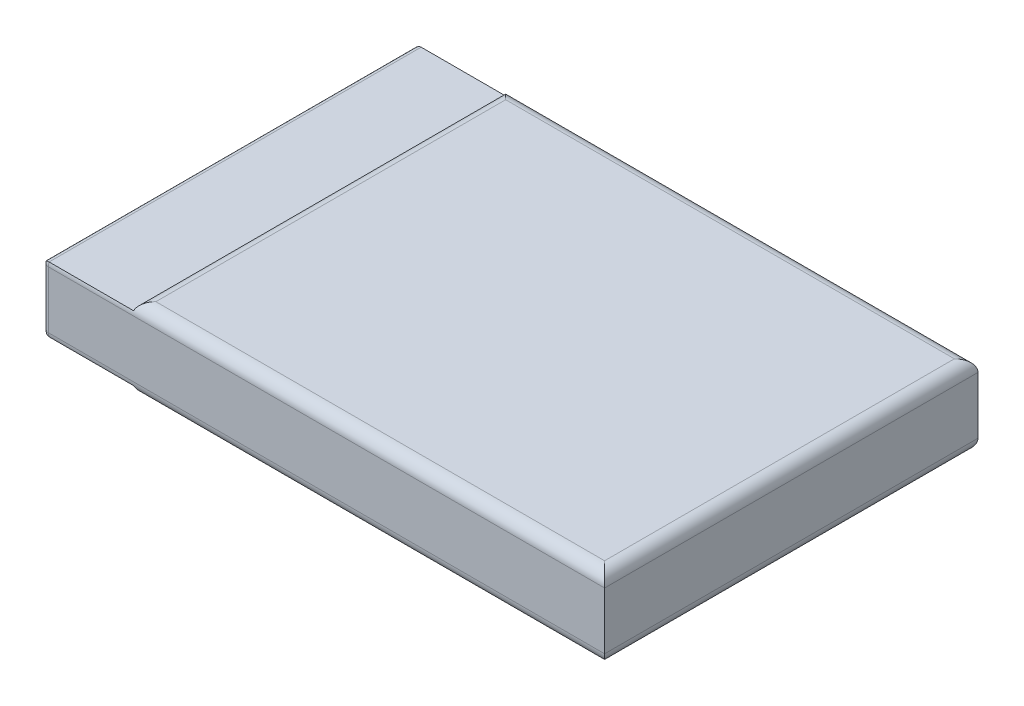
from build123d import *

# Parameters (mm, degrees)
SKETCH1_W           = 30.48
SKETCH1_H           = 24.13
BOSS_EXTRUDE1_DEPTH = 5.207
SKETCH2_W           = 24.13
SKETCH2_H           = 4.191
BOSS_EXTRUDE2_DEPTH = 5.842
FILLET5_START       = -22
FILLET5_DEPTH       = 37.24
FILLET5_START_2     = -13
FILLET5_2_DEPTH     = 26
FILLET4_R           = 0.381


with BuildPart() as part:
    # Sketch1 → Boss-Extrude1 (new body)
    with BuildSketch(Plane(origin=(0, 0, 0), x_dir=(1, 0, 0), z_dir=(0, 1, 0))):
        Rectangle(SKETCH1_W, SKETCH1_H)
    extrude(amount=BOSS_EXTRUDE1_DEPTH)

    # Sketch2 → Boss-Extrude2 (add)
    with BuildSketch(Plane.ZY.offset(15.24)):
        with Locations((0, 2.6035)):
            Rectangle(SKETCH2_W, SKETCH2_H)
    extrude(amount=BOSS_EXTRUDE2_DEPTH)

    # Fillet5: read off the stored shape, not the designer's step
    # Fillet5 outline → Fillet5 (cut)
    with BuildSketch(Plane.YZ.offset(FILLET5_START)):
        with BuildLine():
            Line((4.445, -12.065), (5.207, -12.065))
            Line((5.207, -12.065), (5.207, -11.303))
            ThreePointArc((5.207, -11.303), (4.983815367, -11.841815367), (4.445, -12.065))
        make_face()
        with BuildLine():
            ThreePointArc((0.762, -12.065), (0.223184633, -11.841815367), (0, -11.303))
            Line((0, -11.303), (0, -12.065))
            Line((0, -12.065), (0.762, -12.065))
        make_face()
        with BuildLine():
            Line((5.207, 12.065), (4.445, 12.065))
            ThreePointArc((4.445, 12.065), (4.983815367, 11.841815367), (5.207, 11.303))
            Line((5.207, 11.303), (5.207, 12.065))
        make_face()
        with BuildLine():
            Line((0.762, 12.065), (0, 12.065))
            Line((0, 12.065), (0, 11.303))
            ThreePointArc((0, 11.303), (0.223184633, 11.841815367), (0.762, 12.065))
        make_face()
    extrude(amount=FILLET5_DEPTH, mode=Mode.SUBTRACT)

    # Fillet5 2 outline → Fillet5 2 (cut)
    with BuildSketch(Plane.XY.offset(FILLET5_START_2)):
        with BuildLine():
            Line((-15.24, 5.207), (-15.24, 4.699))
            ThreePointArc((-15.24, 4.699), (-14.961520415, 5.067170395), (-14.52157951, 5.207))
            Line((-14.52157951, 5.207), (-15.24, 5.207))
        make_face()
        with BuildLine():
            Line((-15.24, 0), (-14.52157951, 0))
            ThreePointArc((-14.52157951, 0), (-14.961520415, 0.139829605), (-15.24, 0.508))
            Line((-15.24, 0.508), (-15.24, 0))
        make_face()
        with BuildLine():
            Line((15.24, 0), (15.24, 0.762))
            ThreePointArc((15.24, 0.762), (15.016815367, 0.223184633), (14.478, 0))
            Line((14.478, 0), (15.24, 0))
        make_face()
        with BuildLine():
            Line((15.24, 5.207), (14.478, 5.207))
            ThreePointArc((14.478, 5.207), (15.016815367, 4.983815367), (15.24, 4.445))
            Line((15.24, 4.445), (15.24, 5.207))
        make_face()
    extrude(amount=FILLET5_2_DEPTH, mode=Mode.SUBTRACT)

    # Fillet4
    # the kernel refuses this fillet: 0.381 mm, written as the material it takes off along each edge
    with BuildSketch(Plane(origin=(-21.082, 0.762, -12.065), x_dir=(1, 0, 0), z_dir=(0, 1, 0))) as fillet4_piece_1:
        with BuildLine():
            CenterArc((FILLET4_R, -FILLET4_R), FILLET4_R, 90, 90)
            Line((0, -FILLET4_R), (0, 0))
            Line((0, 0), (FILLET4_R, 0))
        make_face()
    extrude(amount=3.683, mode=Mode.SUBTRACT)
    with BuildSketch(Plane(origin=(-21.082, 4.445, 12.065), x_dir=(0, 0, -1), z_dir=(0, -1, 0))) as fillet4_piece_2:
        with BuildLine():
            CenterArc((FILLET4_R, FILLET4_R), FILLET4_R, 180, 90)
            Line((0, FILLET4_R), (0, 0))
            Line((0, 0), (FILLET4_R, 0))
        make_face()
    extrude(amount=3.683, mode=Mode.SUBTRACT)
    with BuildSketch(Plane(origin=(-21.082, 0.508, 12.973920489), x_dir=(0, 1, 0), z_dir=(0, 0, -1)), Plane(origin=(-21.082, 4.699, -12.973920489), x_dir=(0, -1, 0), z_dir=(0, 0, 1))) as fillet4_piece_3:
        with BuildLine():
            CenterArc((FILLET4_R, FILLET4_R), FILLET4_R, 180, 90)
            Line((0, FILLET4_R), (0, 0))
            Line((0, 0), (FILLET4_R, 0))
        make_face()
    extrude(amount=25.947840979, mode=Mode.SUBTRACT)
    with BuildSketch(Plane(origin=(-21.082, 4.444999999, 11.302999999), x_dir=(0, 1.1835443663887322e-09, 1.0), z_dir=(0, -1.0, 1.1835443663887322e-09))) as fillet4_piece_4:
        with BuildLine():
            CenterArc((0.762000001 - FILLET4_R, -FILLET4_R), FILLET4_R, 0, 90)
            Line((0.762000001, -FILLET4_R), (0.762000001, 0))
            Line((0.762000001, 0), (0.762000001 - FILLET4_R, 0))
        make_face()
    revolve(axis=Axis((-21.082, 4.444999999, 11.302999999), (-1, 0, 0)), revolution_arc=91.092291179, mode=Mode.SUBTRACT)
    with BuildSketch(Plane(origin=(-21.082, 0.762000001, 11.302999999), x_dir=(0, -0.9998182859562426, -0.019062923897481165), z_dir=(0, 0.019062923897481165, -0.9998182859562426))) as fillet4_piece_5:
        with BuildLine():
            CenterArc((0.762000001 - FILLET4_R, -FILLET4_R), FILLET4_R, 0, 90)
            Line((0.762000001, -FILLET4_R), (0.762000001, 0))
            Line((0.762000001, 0), (0.762000001 - FILLET4_R, 0))
        make_face()
    revolve(axis=Axis((-21.082, 0.762000001, 11.302999999), (-1, 0, 0)), revolution_arc=91.092291179, mode=Mode.SUBTRACT)
    with BuildSketch(Plane(origin=(-21.082, 0.762000001, -11.302999999), x_dir=(0, -1.1835437835944942e-09, -1.0), z_dir=(0, 1.0, -1.1835437835944942e-09))) as fillet4_piece_6:
        with BuildLine():
            CenterArc((0.762000001 - FILLET4_R, -FILLET4_R), FILLET4_R, 360, 90)
            Line((0.762000001, -FILLET4_R), (0.762000001, 0))
            Line((0.762000001, 0), (0.762000001 - FILLET4_R, 0))
        make_face()
    revolve(axis=Axis((-21.082, 0.762000001, -11.302999999), (-1, 0, 0)), revolution_arc=91.092291179, mode=Mode.SUBTRACT)
    with BuildSketch(Plane(origin=(-21.082, 4.444999999, -11.302999999), x_dir=(0, 0.9998182859562423, 0.019062923897497485), z_dir=(0, -0.019062923897497485, 0.9998182859562423))) as fillet4_piece_7:
        with BuildLine():
            CenterArc((0.762000001 - FILLET4_R, -FILLET4_R), FILLET4_R, 0, 90)
            Line((0.762000001 - FILLET4_R, 0), (0.762000001, 0))
            Line((0.762000001, 0), (0.762000001, -FILLET4_R))
        make_face()
    revolve(axis=Axis((-21.082, 4.444999999, -11.302999999), (-1, 0, 0)), revolution_arc=91.092291179, mode=Mode.SUBTRACT)


solid = part.part
